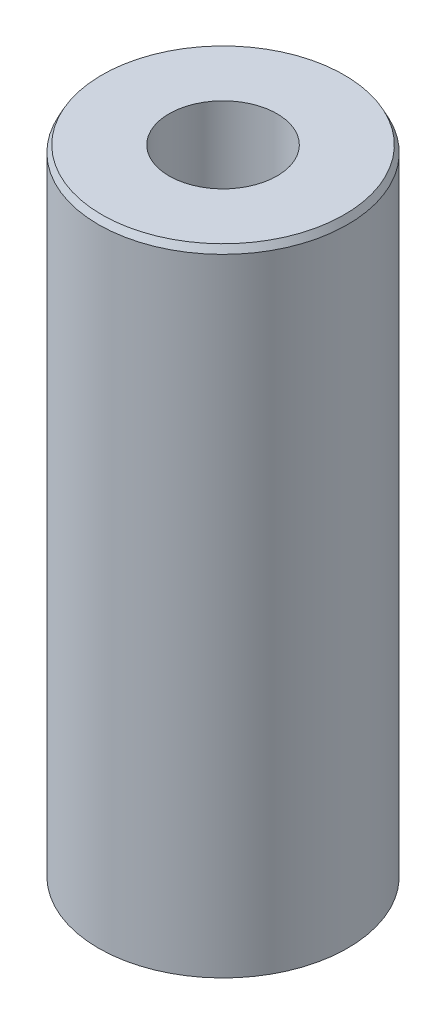
from build123d import *
from OCP.BRepFilletAPI import BRepFilletAPI_MakeChamfer

# Parameters (mm, degrees)
SKETCH1_R           = 17.5
BOSS_EXTRUDE1_DEPTH = 89.447297504
SKETCH2_R           = 7.580546241
CUT_EXTRUDE1_DEPTH  = 93.807968573
CHAMFER1_SIZE       = 0.949377648
CHAMFER1_SIZE2      = 0.485647197


with BuildPart() as part:
    # Sketch1 → Boss-Extrude1 (new body)
    with BuildSketch(Plane(origin=(0, 0, 0), x_dir=(1, 0, 0), z_dir=(0, 1, 0))):
        Circle(SKETCH1_R)
    extrude(amount=BOSS_EXTRUDE1_DEPTH)

    # Sketch2 → Cut-Extrude1 (cut, through all)
    with BuildSketch(Plane(origin=(0, 0, 0), x_dir=(1, 0, 0), z_dir=(0, 1, 0))):
        Circle(SKETCH2_R)
    extrude(amount=CUT_EXTRUDE1_DEPTH, mode=Mode.SUBTRACT)

    # Chamfer1: one chamfer whose edges measure the first distance from different faces: ONE call of the kernel's chamfer builder (chamfer() names one face for all edges)
    chamfer1_edges_1 = [part.edges().sort_by_distance(p)[0] for p in [
        (-17.5, 89.447297504, 0),
    ]]
    chamfer1_side_1 = [part.faces().sort_by_distance(p)[0] for p in [
        (-17.5, 44.723648752, 0),
    ]]
    chamfer1_edges_2 = [part.edges().sort_by_distance(p)[0] for p in [
        (-17.5, 0, 0),
    ]]
    chamfer1_side_2 = [part.faces().sort_by_distance(p)[0] for p in [
        (-17.005025253, 0, 0),
    ]]
    chamfer1 = BRepFilletAPI_MakeChamfer(part.part.solid().wrapped)
    for e in chamfer1_edges_1:
        chamfer1.Add(CHAMFER1_SIZE, CHAMFER1_SIZE2, e.wrapped, chamfer1_side_1[0].wrapped)  # the first distance lies on this face
    for e in chamfer1_edges_2:
        chamfer1.Add(CHAMFER1_SIZE, CHAMFER1_SIZE2, e.wrapped, chamfer1_side_2[0].wrapped)  # the first distance lies on this face
    add(Compound.cast(chamfer1.Shape()), mode=Mode.REPLACE)


solid = part.part
